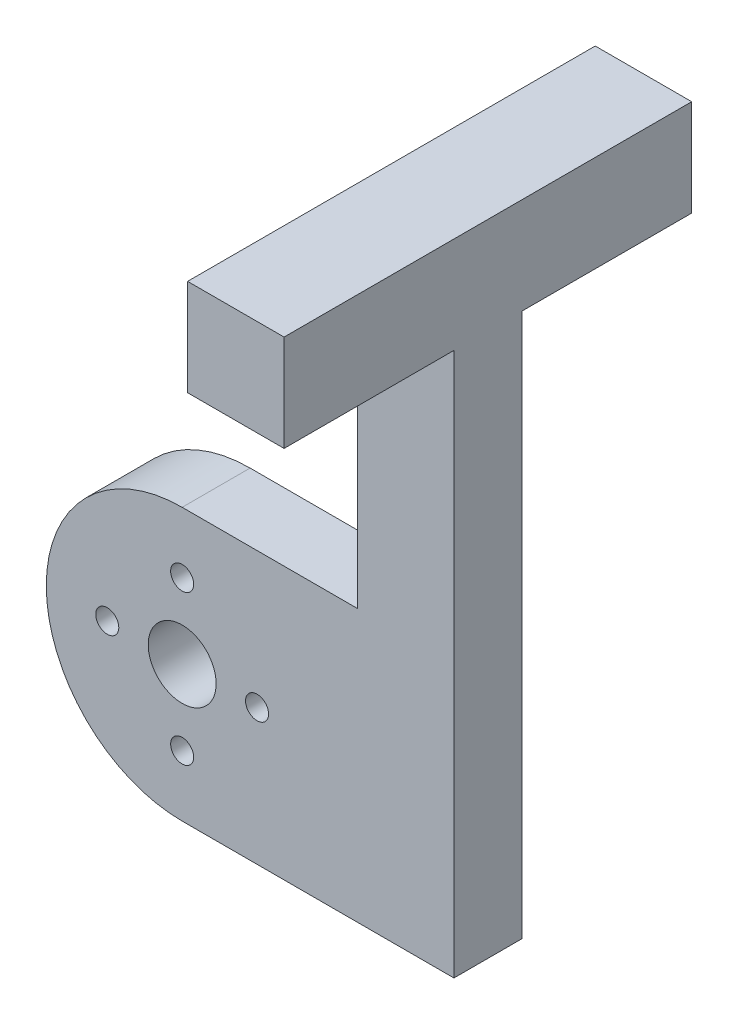
from build123d import *

# Parameters (mm, degrees)
SKETCH2_R           = 1.077000005
BOSS_EXTRUDE1_DEPTH = 3.175
SKETCH3_W           = 9.017
SKETCH3_H           = 9.017
BOSS_EXTRUDE2_DEPTH = 19.05
SKETCH4_R           = 3.175
CUT_EXTRUDE1_DEPTH  = 58.957935729


with BuildPart() as part:
    # Sketch2 → Boss-Extrude1 (new, symmetric)
    with BuildSketch(Plane.XY):
        with BuildLine():
            Line((25.4, 47.117), (16.383, 47.117))
            Line((16.383, 47.117), (16.383, 12.7))
            Line((16.383, 12.7), (0, 12.7))
            ThreePointArc((0, 12.7), (-12.7, 0), (0, -12.7))
            Line((0, -12.7), (25.4, -12.7))
            Line((25.4, -12.7), (25.4, 47.117))
        make_face()
        with Locations((0, 6.99999997)):
            Circle(SKETCH2_R, mode=Mode.SUBTRACT)
        with Locations((6.99999997, 0)):
            Circle(SKETCH2_R, mode=Mode.SUBTRACT)
        with Locations((-6.99999997, 0)):
            Circle(SKETCH2_R, mode=Mode.SUBTRACT)
        with Locations((0, -6.99999997)):
            Circle(SKETCH2_R, mode=Mode.SUBTRACT)
    extrude(amount=BOSS_EXTRUDE1_DEPTH, both=True)

    # Sketch3 → Boss-Extrude2 (add, symmetric)
    with BuildSketch(Plane(origin=(0, 0, 0), x_dir=(-1, 0, 0), z_dir=(0, 0, -1))):
        with Locations((-20.8915, 42.6085)):
            Rectangle(SKETCH3_W, SKETCH3_H)
    extrude(amount=BOSS_EXTRUDE2_DEPTH, both=True)

    # Sketch4 → Cut-Extrude1 (cut, through all)
    with BuildSketch(Plane.XY.offset(3.175)):
        Circle(SKETCH4_R)
    extrude(amount=-CUT_EXTRUDE1_DEPTH, mode=Mode.SUBTRACT)


solid = part.part
